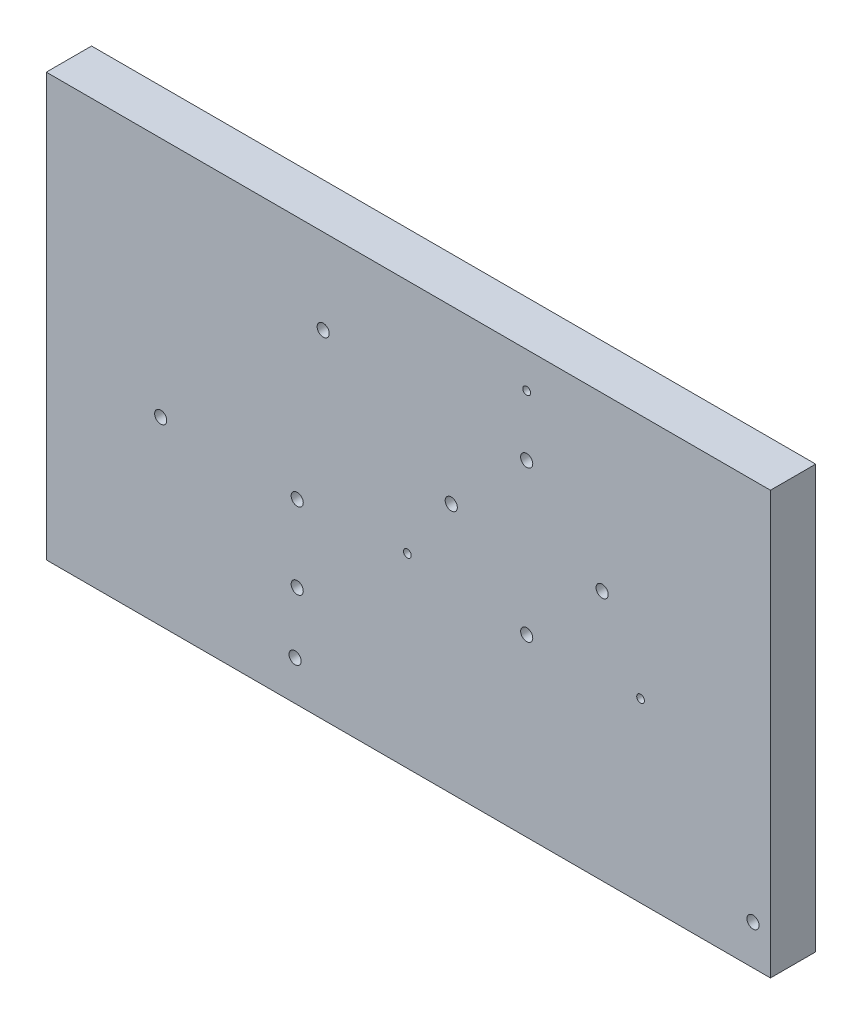
from build123d import *

# Parameters (mm, degrees)
SKETCH1_W           = 304.8
SKETCH1_H           = 177.8
BOSS_EXTRUDE1_DEPTH = 19.05
SKETCH2_R           = 2.5527
SKETCH2_R_2         = 1.63195
CUT_EXTRUDE1_DEPTH  = 178.459495379


with BuildPart() as part:
    # Sketch1 → Boss-Extrude1 (new body)
    with BuildSketch(Plane.XY):
        Rectangle(SKETCH1_W, SKETCH1_H)
    extrude(amount=-BOSS_EXTRUDE1_DEPTH)

    # Sketch2 → Cut-Extrude1 (cut, through all)
    with BuildSketch(Plane.XY):
        with Locations((-104.248655176, -12.758541966)):
            Circle(SKETCH2_R)
        with Locations((-46.793240461, -46.174477312)):
            Circle(SKETCH2_R)
        with Locations((18.05555, 16.7132)):
            Circle(SKETCH2_R)
        with Locations((-35.851762373, 53.135528594)):
            Circle(SKETCH2_R)
        with Locations((-47.693929175, -72.1868)):
            Circle(SKETCH2_R)
        with Locations((49.80555, 48.4632)):
            Circle(SKETCH2_R)
        with Locations((81.55555, 16.7132)):
            Circle(SKETCH2_R)
        with Locations((49.80555, -15.0368)):
            Circle(SKETCH2_R)
        with Locations((-46.793240461, -14.002181532)):
            Circle(SKETCH2_R)
        with Locations((49.80555, 73.8632)):
            Circle(SKETCH2_R_2)
        with Locations((145.05555, -72.1868)):
            Circle(SKETCH2_R)
        with Locations((-0.418847989, -10.556423149)):
            Circle(SKETCH2_R_2)
        with Locations((97.735572958, -14.412920851)):
            Circle(SKETCH2_R_2)
    extrude(amount=-CUT_EXTRUDE1_DEPTH, mode=Mode.SUBTRACT)


solid = part.part
